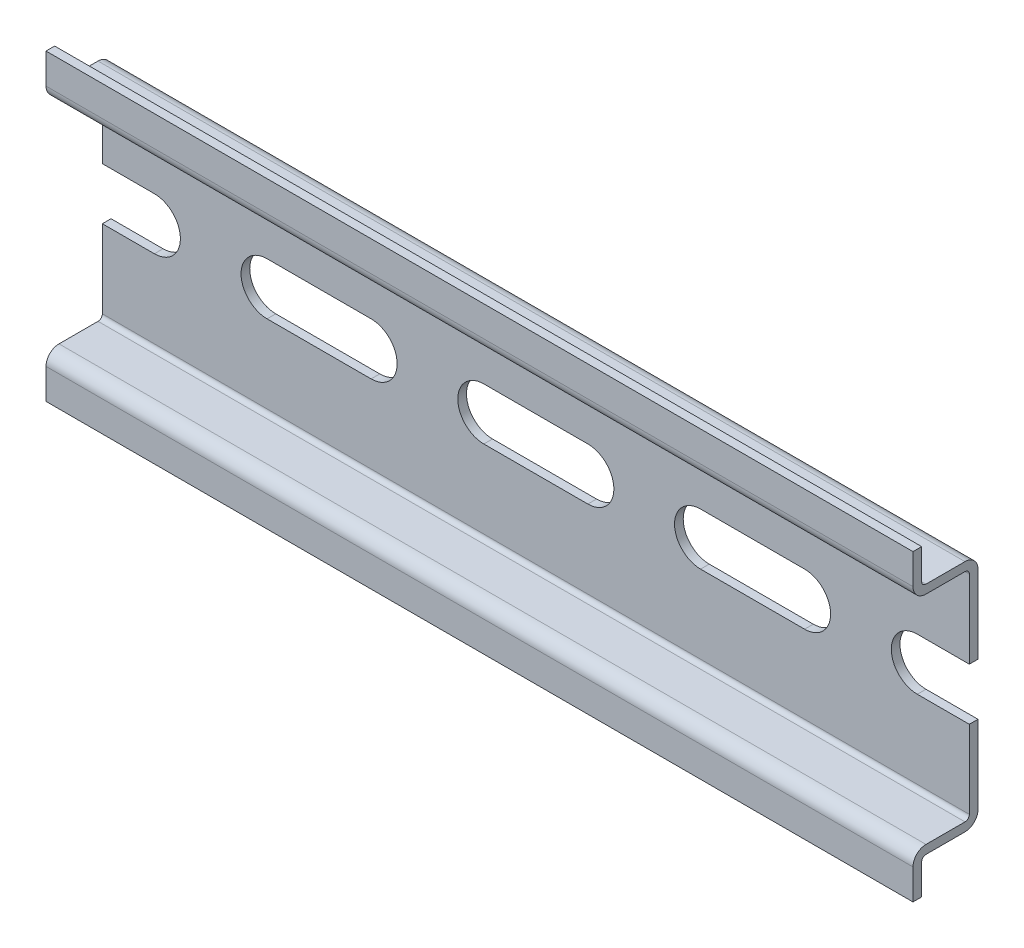
from build123d import *

# Parameters (mm, degrees)
EXTRUDE_1_DEPTH           = 50
HOLE_WIZARD_6_0_6_1_DEPTH = 1
PATTERN_LINEAR_1_COUNT    = 3
PATTERN_LINEAR_1_PITCH    = 25
MIRROR_1_COPY_1_DEPTH     = 1
MIRROR_1_COPY_2_DEPTH     = 1
MIRROR_1_COPY_3_DEPTH     = 1


# Read off the part's stored shape, not the designer's step: Диаметр отверстия Ø6.0 (6)1
with BuildPart() as part:
    # Эскиз1 → Вытянуть-Тонкостенный1 (new, symmetric)
    with BuildSketch(Plane(origin=(0, 0, 0), x_dir=(0, 0, -1), z_dir=(1, 0, 0))):
        with BuildLine():
            Line((-6.5, -17.5), (-6.5, -14))
            ThreePointArc((-6.5, -14), (-6.353553391, -13.646446609), (-6, -13.5))
            Line((-6, -13.5), (-1.5, -13.5))
            ThreePointArc((-1.5, -13.5), (-0.439339828, -13.060660172), (0, -12))
            Line((0, -12), (0, 12))
            ThreePointArc((0, 12), (-0.439339828, 13.060660172), (-1.5, 13.5))
            Line((-1.5, 13.5), (-6, 13.5))
            ThreePointArc((-6, 13.5), (-6.353553391, 13.646446609), (-6.5, 14))
            Line((-6.5, 14), (-6.5, 17.5))
            Line((-6.5, 17.5), (-7.5, 17.5))
            Line((-7.5, 17.5), (-7.5, 14))
            ThreePointArc((-7.5, 14), (-7.060660172, 12.939339828), (-6, 12.5))
            Line((-6, 12.5), (-1.5, 12.5))
            ThreePointArc((-1.5, 12.5), (-1.146446609, 12.353553391), (-1, 12))
            Line((-1, 12), (-1, -12))
            ThreePointArc((-1, -12), (-1.146446609, -12.353553391), (-1.5, -12.5))
            Line((-1.5, -12.5), (-6, -12.5))
            ThreePointArc((-6, -12.5), (-7.060660172, -12.939339828), (-7.5, -14))
            Line((-7.5, -14), (-7.5, -17.5))
            Line((-7.5, -17.5), (-6.5, -17.5))
        make_face()
    extrude(amount=EXTRUDE_1_DEPTH, both=True)

    # Диаметр отверстия Ø6.0 (6)1 outline → Диаметр отверстия Ø6.0 (6)1 (cut)
    with BuildSketch(Plane.XY):
        with BuildLine():
            Line((-6, -3), (6, -3))
            ThreePointArc((6, -3), (9, 0), (6, 3))
            Line((6, 3), (-6, 3))
            ThreePointArc((-6, 3), (-9, 0), (-6, -3))
        make_face()
    hole_wizard_6_0_6_1 = extrude(amount=HOLE_WIZARD_6_0_6_1_DEPTH, mode=Mode.SUBTRACT)

    # Линейный массив1: Диаметр отверстия Ø6.0 (6)1 ×3
    with Locations(*[(i * PATTERN_LINEAR_1_PITCH, 0, 0) for i in range(1, PATTERN_LINEAR_1_COUNT)]):
        add(hole_wizard_6_0_6_1, mode=Mode.SUBTRACT)

    # Зеркальное отражение1 copy 1 sketch → Зеркальное отражение1 copy 1 (cut)
    with BuildSketch(Plane(origin=(-25, 0, 0), x_dir=(-1, 0, 0), z_dir=(0, 0, 1))):
        with BuildLine():
            Line((-6, 3), (6, 3))
            ThreePointArc((6, 3), (9, 0), (6, -3))
            Line((6, -3), (-6, -3))
            ThreePointArc((-6, -3), (-9, 0), (-6, 3))
        make_face()
    extrude(amount=MIRROR_1_COPY_1_DEPTH, mode=Mode.SUBTRACT)

    # Зеркальное отражение1 copy 2 sketch → Зеркальное отражение1 copy 2 (cut)
    with BuildSketch(Plane(origin=(-50, 0, 0), x_dir=(-1, 0, 0), z_dir=(0, 0, 1))):
        with BuildLine():
            Line((-6, 3), (6, 3))
            ThreePointArc((6, 3), (9, 0), (6, -3))
            Line((6, -3), (-6, -3))
            ThreePointArc((-6, -3), (-9, 0), (-6, 3))
        make_face()
    extrude(amount=MIRROR_1_COPY_2_DEPTH, mode=Mode.SUBTRACT)

    # Зеркальное отражение1 copy 3 sketch → Зеркальное отражение1 copy 3 (cut)
    with BuildSketch(Plane(origin=(0, 0, 0), x_dir=(-1, 0, 0), z_dir=(0, 0, 1))):
        with BuildLine():
            Line((-6, 3), (6, 3))
            ThreePointArc((6, 3), (9, 0), (6, -3))
            Line((6, -3), (-6, -3))
            ThreePointArc((-6, -3), (-9, 0), (-6, 3))
        make_face()
    extrude(amount=MIRROR_1_COPY_3_DEPTH, mode=Mode.SUBTRACT)


solid = part.part
